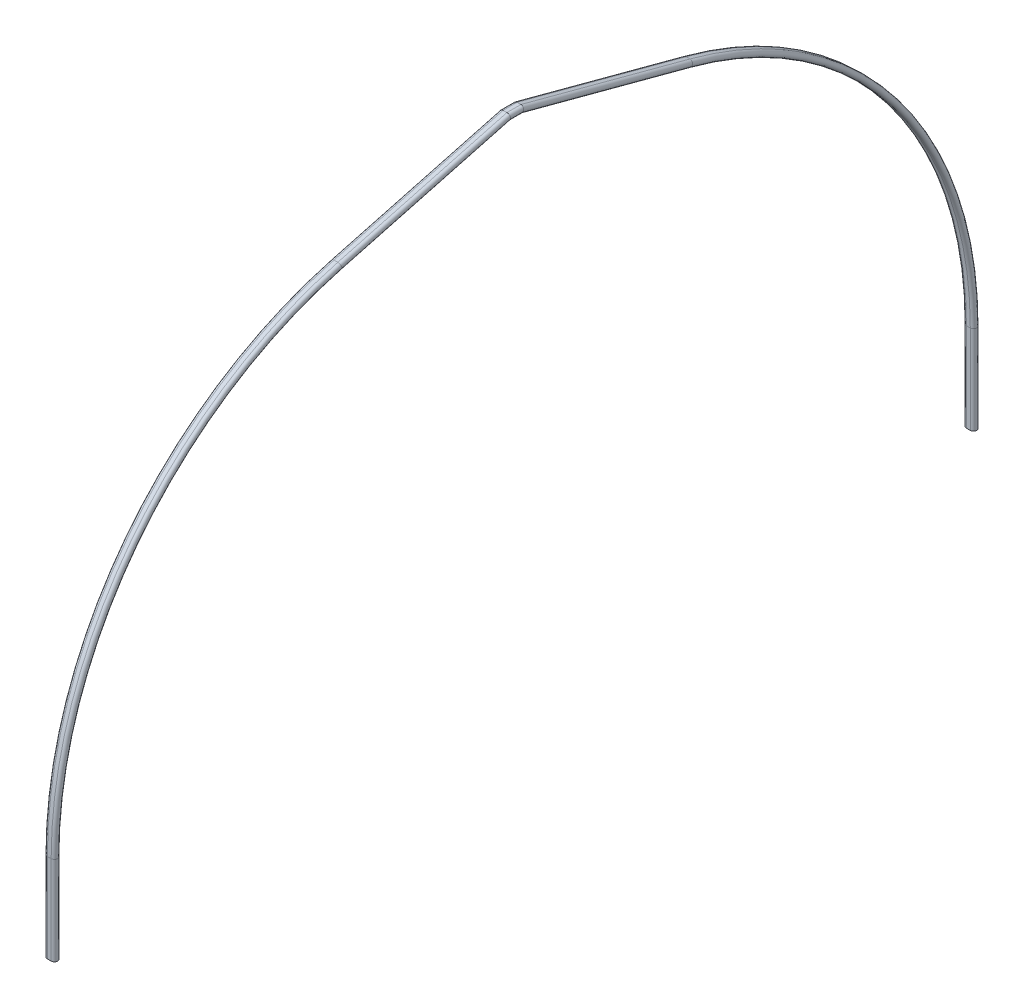
from build123d import *

# Parameters (mm, degrees)
F_3DSKETCH8_R      = 6.35
CUT_EXTRUDE1_DEPTH = 25.4


with BuildPart() as part:
    # Sweep1: sweep along a path in Sketch4
    with BuildLine(Plane(origin=(0, 0, 0), x_dir=(0, 0, -1), z_dir=(1, 0, 0))) as sweep1_path:
        Line((0, 0), (0, 882.85962715))
        ThreePointArc((0, 882.85962715), (788.712459745, 3204.049321919), (2828.305301365, 4564.214747031))
        Line((2828.305301365, 4564.214747031), (4506.553686758, 5011.747649802))
        Line((4506.553686758, 5011.747649802), (4637.446313242, 5011.747649802))
        Line((4637.446313242, 5011.747649802), (6315.694698635, 4564.214747031))
        ThreePointArc((6315.694698635, 4564.214747031), (8355.287540255, 3204.049321919), (9144, 882.85962715))
        Line((9144, 882.85962715), (9144, 0))
    # Sketch1 → Sweep1 (sweep)
    with BuildSketch(Plane(origin=(0, 0, 0), x_dir=(1, 0, 0), z_dir=(0, 1, 0))):
        with BuildLine():
            Line((0, 31.75), (38.1, 31.75))
            ThreePointArc((38.1, 31.75), (69.85, 0), (38.1, -31.75))
            Line((38.1, -31.75), (0, -31.75))
            ThreePointArc((0, -31.75), (-31.75, 0), (0, 31.75))
        make_face()
        with BuildLine():
            Line((0, 20.304779167), (38.1, 20.304779167))
            ThreePointArc((38.1, 20.304779167), (58.404779167, 0), (38.1, -20.304779167))
            Line((38.1, -20.304779167), (0, -20.304779167))
            ThreePointArc((0, -20.304779167), (-20.304779167, 0), (0, 20.304779167))
        make_face(mode=Mode.SUBTRACT)
    sweep(path=sweep1_path.line, transition=Transition.RIGHT)

    # 3DSketch8 → Cut-Extrude1 (cut)
    with BuildSketch(Plane(origin=(0, 4979.997649802, -4552.95), x_dir=(0, 0, 1), z_dir=(0, 1, 0))):
        Circle(F_3DSKETCH8_R)
        with Locations((-38.1, 0)):
            Circle(F_3DSKETCH8_R)
        with Locations((-38.1, 38.1)):
            Circle(F_3DSKETCH8_R)
        with Locations((0, 38.1)):
            Circle(F_3DSKETCH8_R)
    extrude(amount=CUT_EXTRUDE1_DEPTH, mode=Mode.SUBTRACT)


solid = part.part
